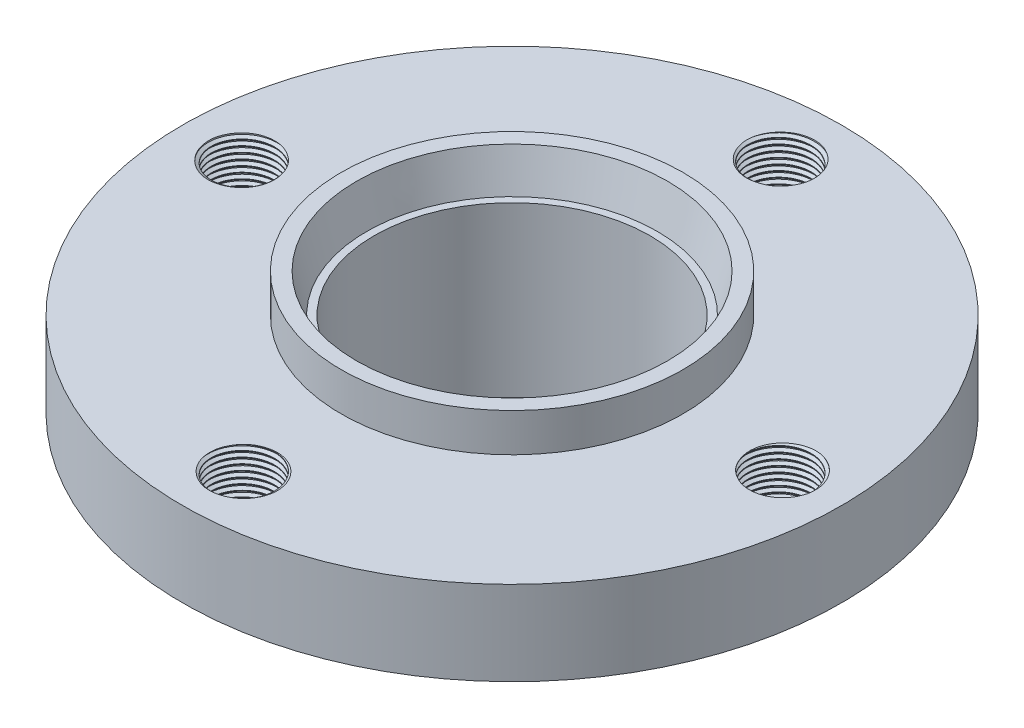
from build123d import *

# Parameters (mm, degrees)
F_1_0MM_DOWEL_HOLE1_D = 16.5
CIRPATTERN1_COUNT     = 4
THREAD1_PITCH         = 1.5
CIRPATTERN2_COUNT     = 4


with BuildPart() as part:
    # Sketch1 → Revolve3 (revolve)
    with BuildSketch(Plane.XY, mode=Mode.PRIVATE) as revolve3_sk:
        Polygon((36, 0), (44.5, 0), (44.5, 22), (86, 22), (86, 44), (44.598447124, 44), (44.598447124, 54), (40.598447124, 54), (37.9189552, 44), (36, 44), align=None)
    revolve(revolve3_sk.sketch.rotate(Axis((0, 0, 0), (0, 1, 0)), 90), axis=Axis((0, 0, 0), (0, 1, 0)))

    # Ø1.0mm Dowel Hole1 (through all)
    with Locations(Plane(origin=(0, 44, 0), x_dir=(1, 0, 0), z_dir=(0, 1, 0))):
        with Locations((0, 70)):
            f_1_0mm_dowel_hole1 = Hole(F_1_0MM_DOWEL_HOLE1_D / 2)

    # CirPattern1: Ø1.0mm Dowel Hole1 ×4 about axis
    cirpattern1_axis = Axis((0, 0, 0), (0, 1, 0))
    for i in range(1, CIRPATTERN1_COUNT):
        add(f_1_0mm_dowel_hole1.rotate(cirpattern1_axis, i * 360 / CIRPATTERN1_COUNT), mode=Mode.SUBTRACT)

    # Thread1: the profile of Thread Profile1 profile screwed along a right-hand helix of 26.666667 turns, 8 arcs to a turn; built about Z, then put on its axis
    thread1_z = Axis((0, 0, 0), (0, 0, 1))
    thread1_corners = [(8.2497, 0, -0.000173205), (8.2497, 0, 1.312673201), (9.061898813, 0, 0.843749998), (9.061898813, 0, 0.468749998)]
    with BuildLine(mode=Mode.PRIVATE) as thread1_profile:
        Line(thread1_corners[0], thread1_corners[1])
        Line(thread1_corners[1], thread1_corners[2])
        Line(thread1_corners[2], thread1_corners[3])
        Line(thread1_corners[3], thread1_corners[0])
    thread1_cap = Face(thread1_profile.wire())
    thread1_turn_angles = [0, 22.5, 45, 67.5, 90, 112.5, 135, 157.5, 180, 202.5, 225, 247.5, 270, 292.5, 315, 337.5, 360]
    thread1_turn_weights = [1, 0.9238795325112867, 1, 0.9238795325112867, 1, 0.9238795325112867, 1, 0.9238795325112867, 1, 0.9238795325112867, 1, 0.9238795325112867, 1, 0.9238795325112867, 1, 0.9238795325112867, 1]
    thread1_turn_rails = [Edge.make_bspline([Vector(p[0], p[1], 0).rotate(thread1_z, thread1_turn_angles[k]) / thread1_turn_weights[k] + Vector(0, 0, p[2] + THREAD1_PITCH * thread1_turn_angles[k] / 360) for k in range(17)], [0, 0, 0, 1, 1, 2, 2, 3, 3, 4, 4, 5, 5, 6, 6, 7, 7, 8, 8, 8], 2, thread1_turn_weights) for p in thread1_corners]
    thread1_turn_sides = [Face.make_surface_from_curves(thread1_turn_rails[p[0]], thread1_turn_rails[p[1]]) for p in [(0, 1), (1, 2), (2, 3), (3, 0)]]
    thread1_last_angles = [9360, 9382.5, 9405, 9427.5, 9450, 9472.5, 9495, 9517.5, 9540, 9562.5, 9585, 9592.5, 9600]
    thread1_last_weights = [1, 0.9238795325112867, 1, 0.9238795325112867, 1, 0.9238795325112867, 1, 0.9238795325112867, 1, 0.9238795325112867, 1, 0.9914448613738125, 1]
    thread1_last_rails = [Edge.make_bspline([Vector(p[0], p[1], 0).rotate(thread1_z, thread1_last_angles[k]) / thread1_last_weights[k] + Vector(0, 0, p[2] + THREAD1_PITCH * thread1_last_angles[k] / 360) for k in range(13)], [0, 0, 0, 1, 1, 2, 2, 3, 3, 4, 4, 5, 5, 6, 6, 6], 2, thread1_last_weights) for p in thread1_corners]
    thread1_last_sides = [Face.make_surface_from_curves(thread1_last_rails[p[0]], thread1_last_rails[p[1]]) for p in [(0, 1), (1, 2), (2, 3), (3, 0)]]
    thread1 = Plane(origin=(-70, 49, 0), x_dir=(-1, 0, 0), z_dir=(0, -1, 0)) * Solid(Shell([*[p.moved(Location((0, 0, THREAD1_PITCH * i))) for i in range(26) for p in thread1_turn_sides], *thread1_last_sides, thread1_cap, thread1_cap.rotate(thread1_z, 9600).moved(Location((0, 0, THREAD1_PITCH * 9600 / 360)))]))
    add(thread1, mode=Mode.SUBTRACT)

    # CirPattern2: Thread1 ×4 about axis
    cirpattern2_axis = Axis((0, 44, 0), (0, -1, 0))
    for i in range(1, CIRPATTERN2_COUNT):
        add(thread1.rotate(cirpattern2_axis, i * 360 / CIRPATTERN2_COUNT), mode=Mode.SUBTRACT)


solid = part.part
